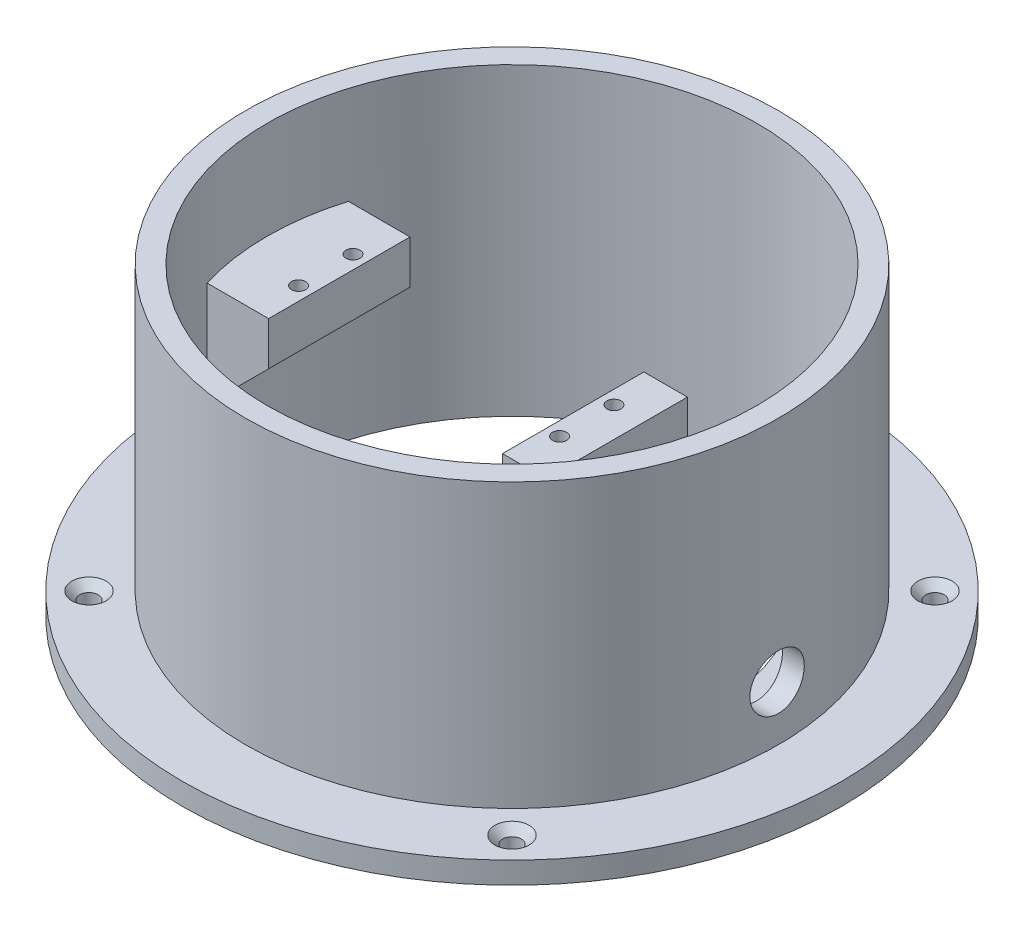
from build123d import *
from build123d.topology import SkipClean

# Parameters (mm, degrees)
CUT_EXTRUDE1_START             = -18.668682
CUT_EXTRUDE1_OUTLINE_R         = 49
CUT_EXTRUDE1_DEPTH             = 16.75
CUT_EXTRUDE1_START_2           = -1.918682
CUT_EXTRUDE1_2_OUTLINE_R       = 49
CUT_EXTRUDE1_2_OUTLINE_R_2     = 45
CUT_EXTRUDE1_2_DEPTH           = 39.25
CUT_EXTRUDE1_3_OUTLINE_R       = 60.625
CUT_EXTRUDE1_3_OUTLINE_R_2     = 49
CUT_EXTRUDE1_3_DEPTH           = 4
CUT_EXTRUDE1_START_3           = -13
CUT_EXTRUDE1_4_DEPTH           = 26
CUT_EXTRUDE2_REACH             = 112.599
CUT_EXTRUDE3_DEPTH             = 103.404986
CUT_EXTRUDE4_DEPTH             = 103.404986
CUT_EXTRUDE5_START             = -12.75
CUT_EXTRUDE5_DEPTH             = 12.75
CUT_EXTRUDE6_START             = -18
CUT_EXTRUDE6_DEPTH             = 18
SKETCH7_W                      = 8
SKETCH7_H                      = 26
BOSS_EXTRUDE1_DEPTH            = 34
CUT_EXTRUDE7_DEPTH             = 101.273532
CUT_EXTRUDE8_REACH             = 111.441
SKETCH9_W                      = 10
SKETCH9_H                      = 24
F_3_4_3_4_DIAMETER_HOLE1_D     = 3.4
F_10_0_10_DIAMETER_HOLE1_D     = 10
F_10_0_10_DIAMETER_HOLE1_DEPTH = 15.90364
F_2_6_2_6_DIAMETER_HOLE1_D     = 2.6
F_2_6_2_6_DIAMETER_HOLE1_DEPTH = 7.2
CHAMFER1_SIZE                  = 1.45


with BuildPart() as part:
    # Cut-Extrude1: read off the stored shape, not the designer's step
    # Cut-Extrude1 outline → Cut-Extrude1 (new body)
    with BuildSketch(Plane(origin=(0, 18.668682, 0), x_dir=(-1, 0, 0), z_dir=(0, 1, 0)).offset(CUT_EXTRUDE1_START)):
        Circle(CUT_EXTRUDE1_OUTLINE_R)
        with BuildLine():
            Line((10.445584, 13), (28.593183, 34.748092))
            ThreePointArc((28.593183, 34.748092), (34.551051, -28.830971), (-29.067401, -34.352383))
            Line((-29.067401, -34.352383), (10.445584, 13))
        make_face(mode=Mode.SUBTRACT)
    extrude(amount=CUT_EXTRUDE1_DEPTH)

    # Cut-Extrude1 2 outline → Cut-Extrude1 2 (add)
    with SkipClean():  # the faces are left unmerged after this step: merging them gives an invalid solid
        with BuildSketch(Plane(origin=(0, 18.668682, 0), x_dir=(-1, 0, 0), z_dir=(0, 1, 0)).offset(CUT_EXTRUDE1_START_2)):
            Circle(CUT_EXTRUDE1_2_OUTLINE_R)
            Circle(CUT_EXTRUDE1_2_OUTLINE_R_2, mode=Mode.SUBTRACT)
        extrude(amount=CUT_EXTRUDE1_2_DEPTH)

    # Cut-Extrude1 3 outline → Cut-Extrude1 3 (add)
    with BuildSketch(Plane(origin=(0, 18.668682, 0), x_dir=(-1, 0, 0), z_dir=(0, 1, 0)).offset(CUT_EXTRUDE1_START)):
        Circle(CUT_EXTRUDE1_3_OUTLINE_R)
        Circle(CUT_EXTRUDE1_3_OUTLINE_R_2, mode=Mode.SUBTRACT)
    extrude(amount=CUT_EXTRUDE1_3_DEPTH)

    # Cut-Extrude1 4 outline → Cut-Extrude1 4 (add)
    with BuildSketch(Plane.XY.offset(CUT_EXTRUDE1_START_3)):
        Polygon((-46.75, 15), (-5.75, 56), (-47, 56), (-47, 15), align=None)
    extrude(amount=CUT_EXTRUDE1_4_DEPTH)

    # Sketch2 → Cut-Extrude2 (cut, up to next)
    with BuildSketch(Plane.XY.offset(13), mode=Mode.PRIVATE) as cut_extrude2_sk1:
        Polygon((-31.75, 56), (-31.75, 30), (-5.75, 56), align=None)
    cut_extrude2_tool1 = extrude(cut_extrude2_sk1.sketch, amount=-CUT_EXTRUDE2_REACH, mode=Mode.PRIVATE) & part.part
    add(cut_extrude2_tool1.solids().sort_by_distance((-23.083333, 47.333333, 13))[0], mode=Mode.SUBTRACT)

    # Sketch3 → Cut-Extrude3 (cut, through all)
    with BuildSketch(Plane.XZ):
        with BuildLine():
            Line((-28.593183, 34.748092), (0.402208, 0))
            Line((0.402208, 0), (29.067401, 34.352383))
            ThreePointArc((29.067401, 34.352383), (0.308816, 44.99894), (-28.593183, 34.748092))
        make_face()
    extrude(amount=-CUT_EXTRUDE3_DEPTH, mode=Mode.SUBTRACT)

    # Sketch4 → Cut-Extrude4 (cut, through all)
    with BuildSketch(Plane.XZ):
        Polygon((0.402208, 0), (11.25, -13), (11.25, 13), align=None)
    extrude(amount=-CUT_EXTRUDE4_DEPTH, mode=Mode.SUBTRACT)

    # Sketch5 → Cut-Extrude5 (cut)
    with BuildSketch(Plane(origin=(0, 16.75, 0), x_dir=(-1, 0, 0), z_dir=(0, 1, 0)).offset(CUT_EXTRUDE5_START)):
        with BuildLine():
            Line((-11.25, -13), (-11.25, 13))
            Line((-11.25, 13), (-29.067401, 34.352383))
            ThreePointArc((-29.067401, 34.352383), (-45, 0), (-29.067401, -34.352383))
            Line((-29.067401, -34.352383), (-11.25, -13))
        make_face()
    extrude(amount=CUT_EXTRUDE5_DEPTH, mode=Mode.SUBTRACT)

    # Sketch6 → Cut-Extrude6 (cut)
    with BuildSketch(Plane(origin=(0, 56, 0), x_dir=(-1, 0, 0), z_dir=(0, 1, 0)).offset(CUT_EXTRUDE6_START)):
        with BuildLine():
            Line((43.081318, 13), (31.75, 13))
            Line((31.75, 13), (31.75, -13))
            Line((31.75, -13), (43.081318, -13))
            ThreePointArc((43.081318, -13), (45, 0), (43.081318, 13))
        make_face()
    extrude(amount=CUT_EXTRUDE6_DEPTH, mode=Mode.SUBTRACT)

    # Sketch7 → Boss-Extrude1 (add)
    with BuildSketch(Plane(origin=(0, 4, 0), x_dir=(-1, 0, 0), z_dir=(0, 1, 0))):
        with Locations((-15.25, 0)):
            Rectangle(SKETCH7_W, SKETCH7_H)
    extrude(amount=BOSS_EXTRUDE1_DEPTH)

    # Sketch8 → Cut-Extrude7 (cut, through all)
    with BuildSketch(Plane(origin=(0, 4, 0), x_dir=(-1, 0, 0), z_dir=(0, 1, 0))):
        with BuildLine():
            Line((-29.479537, -22.359715), (-24.25, -16.092635))
            Line((-24.25, -16.092635), (-24.25, 16.092635))
            Line((-24.25, 16.092635), (-29.479537, 22.359715))
            ThreePointArc((-29.479537, 22.359715), (-37, 0), (-29.479537, -22.359715))
        make_face()
    extrude(amount=-CUT_EXTRUDE7_DEPTH, mode=Mode.SUBTRACT)

    # Sketch9 → Cut-Extrude8 (cut, up to next)
    with BuildSketch(Plane.ZY.offset(-11.25), mode=Mode.PRIVATE) as cut_extrude8_sk1:
        with Locations((0, 17)):
            Rectangle(SKETCH9_W, SKETCH9_H)
    cut_extrude8_tool1 = extrude(cut_extrude8_sk1.sketch, amount=-CUT_EXTRUDE8_REACH, mode=Mode.PRIVATE) & part.part
    add(cut_extrude8_tool1.solids().sort_by_distance((11.25, 17, 0))[0], mode=Mode.SUBTRACT)

    # Ø3.4 (3.4) Diameter Hole1 (through all)
    with Locations(Plane(origin=(0, 4, 0), x_dir=(1, 0, 0), z_dir=(0, 1, 0))):
        with Locations((38.890873, 38.890873), (38.890873, -38.890873), (-38.890873, -38.890873), (-38.890873, 38.890873)):
            Hole(F_3_4_3_4_DIAMETER_HOLE1_D / 2)

    # Ø10.0 (10) Diameter Hole1
    with Locations(Plane.ZY.offset(-44.72136)):
        with Locations((0, 14)):
            Hole(F_10_0_10_DIAMETER_HOLE1_D / 2, depth=F_10_0_10_DIAMETER_HOLE1_DEPTH)

    # Ø2.6 (2.6) Diameter Hole1
    with Locations(Plane(origin=(0, 38, 0), x_dir=(1, 0, 0), z_dir=(0, 1, 0))):
        with Locations((13.75, -5), (13.75, 5), (-34.25, 5), (-34.25, -5)):
            Hole(F_2_6_2_6_DIAMETER_HOLE1_D / 2, depth=F_2_6_2_6_DIAMETER_HOLE1_DEPTH)

    # Chamfer1
    chamfer1_edges = [part.edges().sort_by_distance(p)[0] for p in [
        (-37.190873, 4, -38.890873),
        (-37.190873, 4, 38.890873),
        (40.590873, 4, 38.890873),
        (40.590873, 4, -38.890873),
    ]]
    chamfer(chamfer1_edges, length=CHAMFER1_SIZE)


solid = part.part
